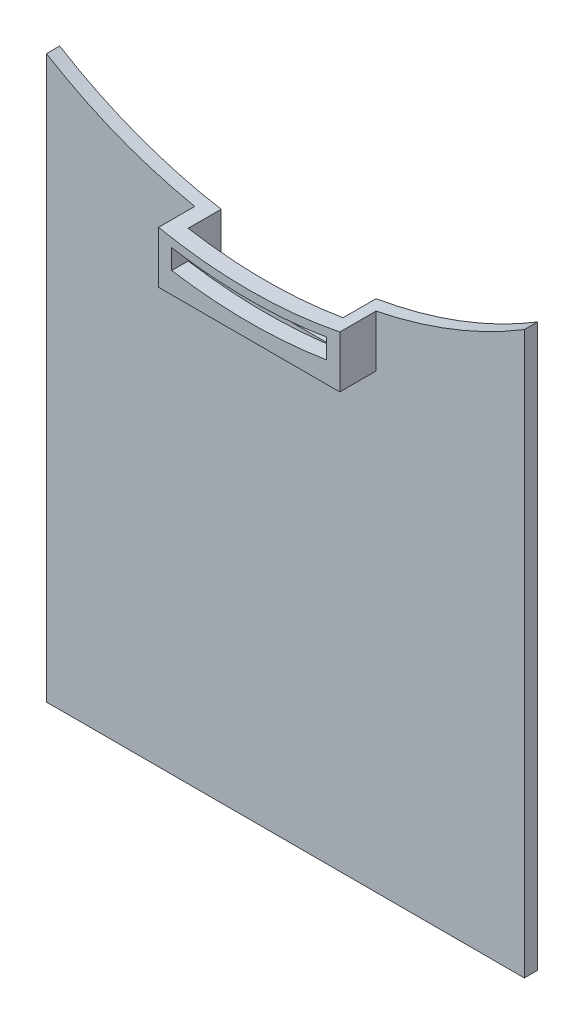
from build123d import *

# Parameters (mm, degrees)
EXTRUDE_1_DEPTH      = 2
EXTRUDE_6_DEPTH      = 7.5
EXTRUDE_7_REACH      = 79.862
EXTRUDE_7_END_RADIUS = 69.53125
FIX_BUTTON_W         = 2
FIX_BUTTON_H         = 5.5
SKETCH_4_3_W         = 23.5
SKETCH_4_3_H         = 5
CUT_EXTRUDE_1_DEPTH  = 7.5


with BuildPart() as part:
    # battery_upper_face → 凸台-拉伸1 (new body)
    with BuildSketch(Plane.XY):
        with BuildLine():
            Line((-36.25, 41.697176934), (-36.25, -43.5))
            Line((-36.25, -43.5), (36.25, -43.5))
            Line((36.25, -43.5), (36.25, 41.697176934))
            ThreePointArc((36.25, 41.697176934), (24.43659174, 35.935568802), (11.75, 32.5))
            Line((11.75, 32.5), (11.75, 31.2))
            Line((11.75, 31.2), (11.75, 28.2))
            Line((11.75, 28.2), (11.75, 26))
            Line((11.75, 26), (11.75, 25))
            Line((11.75, 25), (4e-09, 25))
            Line((4e-09, 25), (-11.75, 25))
            Line((-11.75, 25), (-11.75, 26))
            Line((-11.75, 26), (-11.75, 28.2))
            Line((-11.75, 28.2), (-11.75, 31.2))
            Line((-11.75, 31.2), (-11.75, 32.5))
            ThreePointArc((-11.75, 32.5), (-24.43659174, 35.935568802), (-36.25, 41.697176934))
        make_face()
    extrude(amount=EXTRUDE_1_DEPTH)

    # 草图2<9> → 凸台-拉伸6 (add)
    with BuildSketch(Plane.XY):
        with BuildLine():
            ThreePointArc((11.75, 32.5), (0, 31.5), (-11.75, 32.5))
            Line((-11.75, 32.5), (-11.75, 31.2))
            ThreePointArc((-11.75, 31.2), (0, 30.218355859), (11.75, 31.2))
            Line((11.75, 31.2), (11.75, 32.5))
        make_face()
        with BuildLine():
            ThreePointArc((11.75, 28.2), (0, 27.25826391), (-11.75, 28.2))
            Line((-11.75, 28.2), (-11.75, 25))
            Line((-11.75, 25), (11.75, 25))
            Line((11.75, 25), (11.75, 28.2))
        make_face()
    extrude(amount=EXTRUDE_6_DEPTH)

    # 凸台-拉伸7: up to this cylinder (the profile starts outside it)
    extrude_7_end = Plane(origin=(0, 101.03125, 4.75), z_dir=(0, 0, -1)) * Cylinder(EXTRUDE_7_END_RADIUS, 299.7865, mode=Mode.PRIVATE)
    # fix_button → 凸台-拉伸7 (add, up to the surface)
    with BuildSketch(Plane.XZ.offset(-25), mode=Mode.PRIVATE) as extrude_7_sk1:
        with Locations((-12.75, 4.75)):
            Rectangle(FIX_BUTTON_W, FIX_BUTTON_H)
    extrude_7_tool1 = extrude(extrude_7_sk1.sketch, amount=-EXTRUDE_7_REACH, mode=Mode.PRIVATE) - extrude_7_end
    add(extrude_7_tool1.solids().sort_by_distance((-12.75, 25, 4.75))[0])
    # fix_button → 凸台-拉伸7 (add, up to the surface)
    with BuildSketch(Plane.XZ.offset(-25), mode=Mode.PRIVATE) as extrude_7_sk2:
        with Locations((12.75, 4.75)):
            Rectangle(FIX_BUTTON_W, FIX_BUTTON_H)
    extrude_7_tool2 = extrude(extrude_7_sk2.sketch, amount=-EXTRUDE_7_REACH, mode=Mode.PRIVATE) - extrude_7_end
    add(extrude_7_tool2.solids().sort_by_distance((12.75, 25, 4.75))[0])

    # 草图4<3> → 切除-拉伸1 (cut)
    with BuildSketch(Plane.XZ.offset(-25)):
        with Locations((0, 2.5)):
            Rectangle(SKETCH_4_3_W, SKETCH_4_3_H)
    extrude(amount=-CUT_EXTRUDE_1_DEPTH, mode=Mode.SUBTRACT)


solid = part.part
